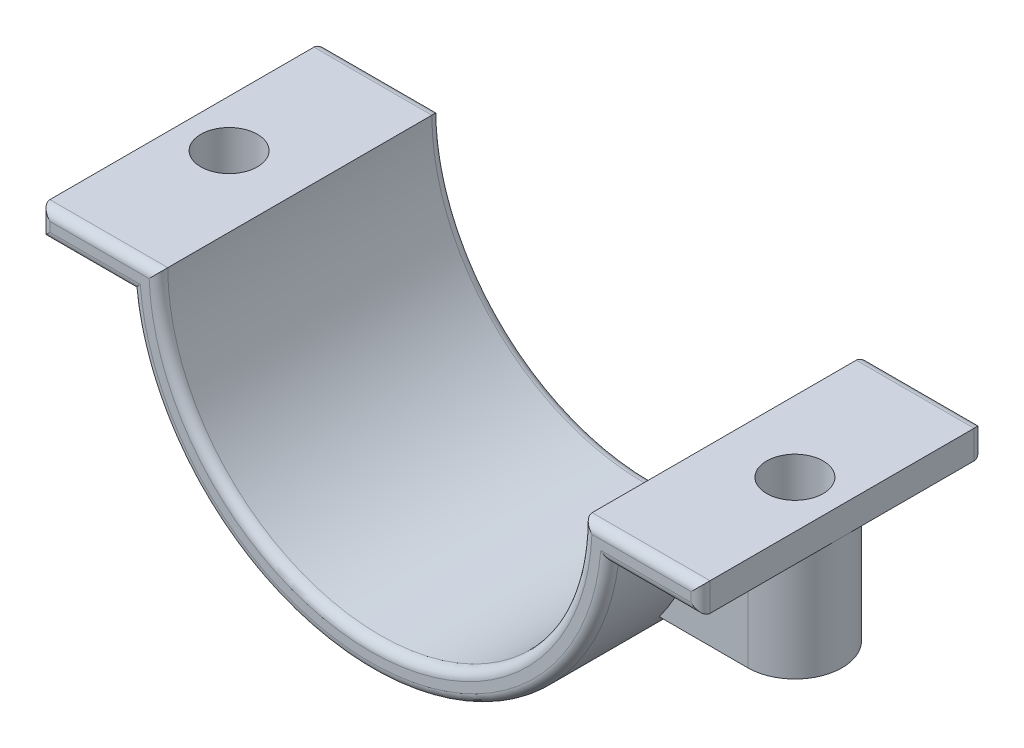
from build123d import *

# Parameters (mm, degrees)
BOSS_EXTRUDE1_DEPTH = 15
BOSS_EXTRUDE2_REACH = 58.23
BOSS_EXTRUDE2_START = 12
SKETCH4_R           = 3
FILLET1_R           = 1
SKETCH4_4_R         = 3
CUT_EXTRUDE1_DEPTH  = 45.229515196
SKETCH5_R           = 3
CUT_EXTRUDE2_DEPTH  = 41.926764018


with BuildPart() as part:
    # Sketch2 → Boss-Extrude1 (new, symmetric)
    with BuildSketch(Plane.XY):
        with BuildLine():
            Line((-35, 0), (-22.5, 0))
            ThreePointArc((-22.5, 0), (0, -22.5), (22.5, 0))
            Line((22.5, 0), (35, 0))
            Line((35, 0), (35, -3))
            Line((35, -3), (25.322914524, -3))
            ThreePointArc((25.322914524, -3), (0, -25.5), (-25.322914524, -3))
            Line((-25.322914524, -3), (-35, -3))
            Line((-35, -3), (-35, 0))
        make_face()
    extrude(amount=BOSS_EXTRUDE1_DEPTH, both=True)

    # Sketch4 → Boss-Extrude2 (add, up to next)
    with BuildSketch(Plane.XZ.offset(3).offset(BOSS_EXTRUDE2_START), mode=Mode.PRIVATE) as boss_extrude2_sk1:
        with BuildLine():
            Line((18, 5), (18, -5))
            Line((18, -5), (30, -5))
            ThreePointArc((30, -5), (35, 0), (30, 5))
            Line((30, 5), (18, 5))
        make_face()
        with BuildLine():
            ThreePointArc((25.322914524, -1.767730594), (25, 0), (25.322914524, 1.767730594))
            Line((25.322914524, 1.767730594), (25.322914524, -1.767730594))
        make_face(mode=Mode.SUBTRACT)
        with Locations((30, 0)):
            Circle(SKETCH4_R, mode=Mode.SUBTRACT)
    boss_extrude2_tool1 = extrude(boss_extrude2_sk1.sketch, amount=-BOSS_EXTRUDE2_REACH, mode=Mode.PRIVATE) - part.part
    boss_extrude2 = boss_extrude2_tool1.solids().sort_by_distance((24, -15, 4.802769))[0]
    add(boss_extrude2)

    # Fillet1
    fillet1_edges = [part.edges().sort_by_distance(p)[0] for p in [
        (-30.161457262, -3, -15),
        (0, -25.5, -15),
        (30.161457262, -3, -15),
        (35, -1.5, -15),
        (28.75, 0, -15),
        (0, -22.5, -15),
        (-28.75, 0, -15),
        (-35, -1.5, -15),
        (-28.75, 0, 15),
        (0, -22.5, 15),
        (28.75, 0, 15),
        (35, -1.5, 15),
        (30.161457262, -3, 15),
        (0, -25.5, 15),
        (-30.161457262, -3, 15),
        (-35, -1.5, 15),
    ]]
    fillet(fillet1_edges, radius=FILLET1_R)

    # Sketch4<4> → Cut-Extrude1 (cut, through all)
    with BuildSketch(Plane.XZ.offset(3)):
        with Locations((30, 0)):
            Circle(SKETCH4_4_R)
    extrude(amount=-CUT_EXTRUDE1_DEPTH, mode=Mode.SUBTRACT)

    # Mirror1: Boss-Extrude2 across plane
    add(boss_extrude2.mirror(Plane(origin=(0, 0, 0), x_dir=(0, 0, 1), z_dir=(1, 0, 0))))

    # Sketch5 → Cut-Extrude2 (cut, through all)
    with BuildSketch(Plane.XZ.offset(15)):
        with Locations((-30, 0)):
            Circle(SKETCH5_R)
    extrude(amount=-CUT_EXTRUDE2_DEPTH, mode=Mode.SUBTRACT)


solid = part.part
